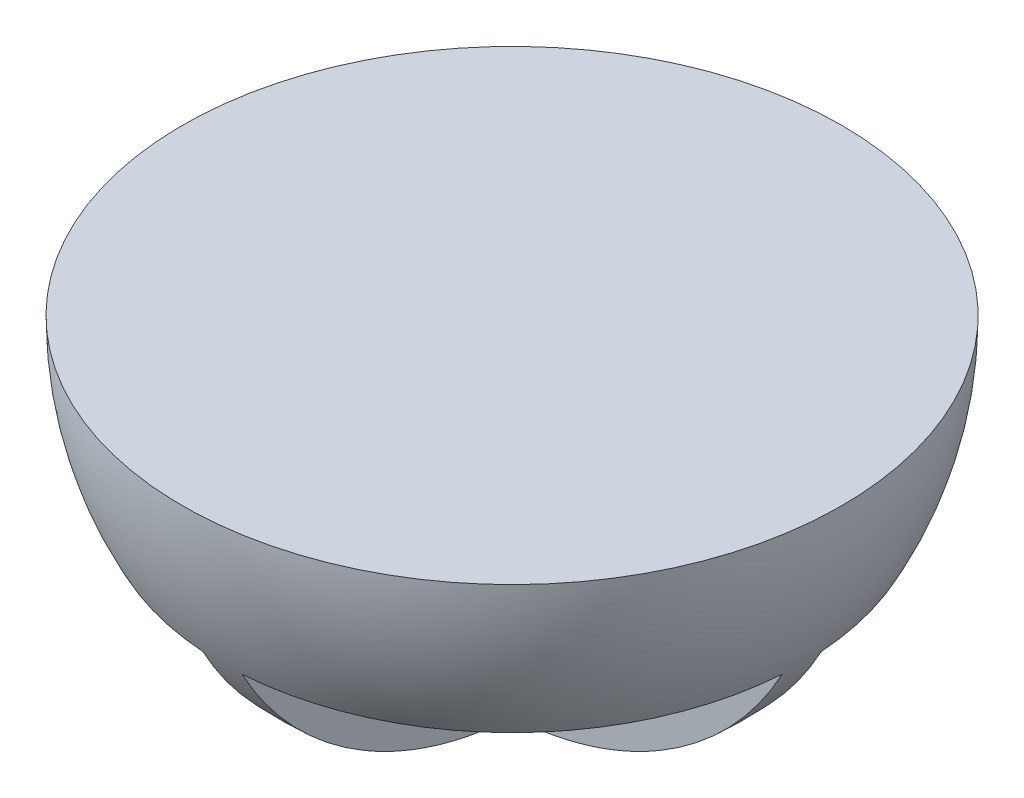
from build123d import *

# Parameters (mm, degrees)
CUT_EXTRUDE1_REACH = 76.543
CUT_EXTRUDE1_START = -16
SKETCH2_R          = 0.75


with BuildPart() as part:
    # Sketch1 → Revolve1 (revolve)
    with BuildSketch(Plane.XY):
        with BuildLine():
            Line((0, -33.8), (0, 0))
            Line((0, 0), (33.8, 0))
            ThreePointArc((33.8, 0), (23.900209204, -23.900209204), (0, -33.8))
        make_face()
    revolve(axis=Axis((0, -33.8, 0), (0, 1, 0)))

    # Sketch2 → Cut-Extrude1 (cut, up to next)
    with BuildSketch(Plane(origin=(0, 0, 0), x_dir=(1, 0, 0), z_dir=(0, 1, 0)).offset(CUT_EXTRUDE1_START), mode=Mode.PRIVATE) as cut_extrude1_sk1:
        with BuildLine():
            Line((-2, 2), (-2, 33.740776517))
            ThreePointArc((-2, 33.740776517), (-23.900209204, 23.900209204), (-33.740776517, 2))
            Line((-33.740776517, 2), (-2, 2))
        make_face()
    cut_extrude1_tool1 = extrude(cut_extrude1_sk1.sketch, amount=-CUT_EXTRUDE1_REACH, mode=Mode.PRIVATE) & part.part
    # Sketch2 → Cut-Extrude1 (cut, up to next)
    with BuildSketch(Plane(origin=(0, 0, 0), x_dir=(1, 0, 0), z_dir=(0, 1, 0)).offset(CUT_EXTRUDE1_START), mode=Mode.PRIVATE) as cut_extrude1_sk2:
        with BuildLine():
            ThreePointArc((33.740776517, 2), (23.900209204, 23.900209204), (2, 33.740776517))
            Line((2, 33.740776517), (2, 2))
            Line((2, 2), (33.740776517, 2))
        make_face()
    cut_extrude1_tool2 = extrude(cut_extrude1_sk2.sketch, amount=-CUT_EXTRUDE1_REACH, mode=Mode.PRIVATE) & part.part
    # Sketch2 → Cut-Extrude1 (cut, up to next)
    with BuildSketch(Plane(origin=(0, 0, 0), x_dir=(1, 0, 0), z_dir=(0, 1, 0)).offset(CUT_EXTRUDE1_START), mode=Mode.PRIVATE) as cut_extrude1_sk3:
        with BuildLine():
            Line((-2, -33.740776517), (-2, -2))
            Line((-2, -2), (-33.740776517, -2))
            ThreePointArc((-33.740776517, -2), (-23.900209204, -23.900209204), (-2, -33.740776517))
        make_face()
    cut_extrude1_tool3 = extrude(cut_extrude1_sk3.sketch, amount=-CUT_EXTRUDE1_REACH, mode=Mode.PRIVATE) & part.part
    # Sketch2 → Cut-Extrude1 (cut, up to next)
    with BuildSketch(Plane(origin=(0, 0, 0), x_dir=(1, 0, 0), z_dir=(0, 1, 0)).offset(CUT_EXTRUDE1_START), mode=Mode.PRIVATE) as cut_extrude1_sk4:
        with BuildLine():
            Line((33.740776517, -2), (2, -2))
            Line((2, -2), (2, -33.740776517))
            ThreePointArc((2, -33.740776517), (23.900209204, -23.900209204), (33.740776517, -2))
        make_face()
    cut_extrude1_tool4 = extrude(cut_extrude1_sk4.sketch, amount=-CUT_EXTRUDE1_REACH, mode=Mode.PRIVATE) & part.part
    # Sketch2 → Cut-Extrude1 (cut, up to next)
    with BuildSketch(Plane(origin=(0, 0, 0), x_dir=(1, 0, 0), z_dir=(0, 1, 0)).offset(CUT_EXTRUDE1_START), mode=Mode.PRIVATE) as cut_extrude1_sk5:
        Circle(SKETCH2_R)
    cut_extrude1_tool5 = extrude(cut_extrude1_sk5.sketch, amount=-CUT_EXTRUDE1_REACH, mode=Mode.PRIVATE) & part.part
    add(cut_extrude1_tool1.solids().sort_by_distance((-15.227899, -16, -15.227899))[0], mode=Mode.SUBTRACT)
    add(cut_extrude1_tool2.solids().sort_by_distance((15.227899, -16, -15.227899))[0], mode=Mode.SUBTRACT)
    add(cut_extrude1_tool3.solids().sort_by_distance((-15.227899, -16, 15.227899))[0], mode=Mode.SUBTRACT)
    add(cut_extrude1_tool4.solids().sort_by_distance((15.227899, -16, 15.227899))[0], mode=Mode.SUBTRACT)
    add(cut_extrude1_tool5.solids().sort_by_distance((0, -16, 0))[0], mode=Mode.SUBTRACT)


solid = part.part
